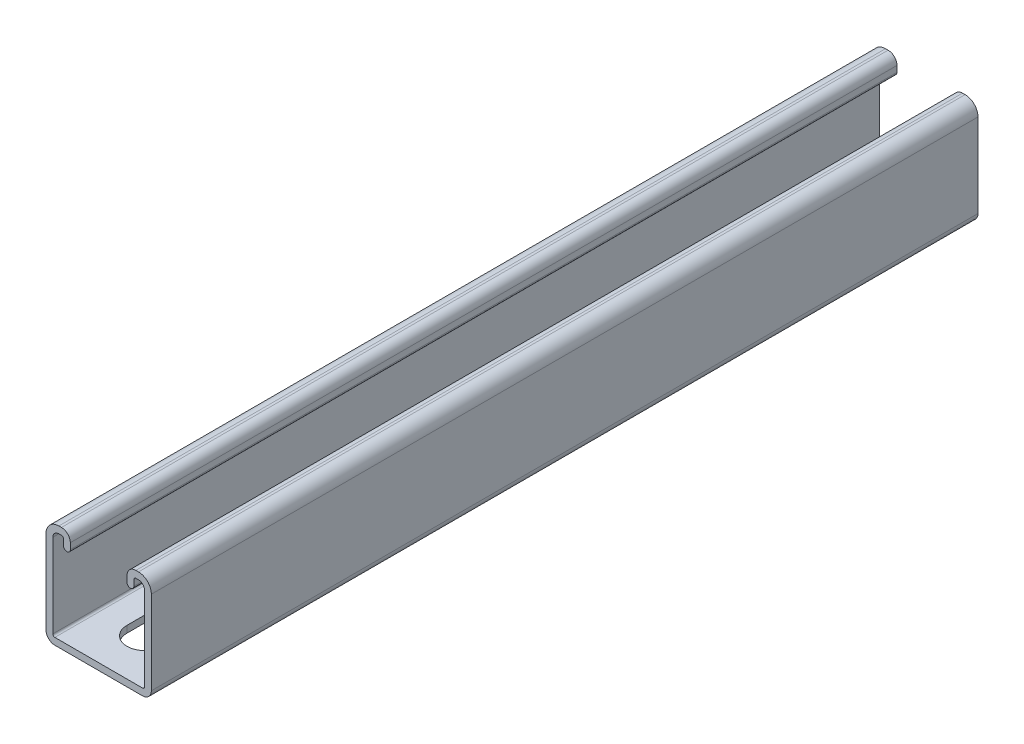
from build123d import *

# Parameters (mm, degrees)
PRIMARY_EXTRUSION_DEPTH = 323.85
SLOT_CUT_REACH          = 329.121
LPATTERN1_COUNT         = 7
LPATTERN1_PITCH         = 50.8


with BuildPart() as part:
    # Sketch1 → Primary Extrusion (new body)
    with BuildSketch(Plane.XY):
        with BuildLine():
            Line((17.176891111, -17.970376528), (-17.176891111, -17.970376528))
            ThreePointArc((-17.176891111, -17.970376528), (-17.738157147, -17.737892523), (-17.970641152, -17.176626487))
            Line((-17.970641152, -17.176626487), (-17.970641152, 15.589126408))
            ThreePointArc((-17.970641152, 15.589126408), (-17.273189139, 17.272924515), (-15.589391032, 17.970376528))
            Line((-15.589391032, 17.970376528), (-14.57342631, 17.970376528))
            ThreePointArc((-14.57342631, 17.970376528), (-14.012171972, 17.737897369), (-13.779692813, 17.176643031))
            Line((-13.779692813, 17.176643031), (-13.779692813, 14.833457753))
            ThreePointArc((-13.779692813, 14.833457753), (-12.446175174, 13.499940114), (-11.112657535, 14.833457753))
            Line((-11.112657535, 14.833457753), (-11.112657535, 17.176643031))
            ThreePointArc((-11.112657535, 17.176643031), (-12.126293241, 19.623776099), (-14.57342631, 20.637411806))
            Line((-14.57342631, 20.637411806), (-15.589391032, 20.637411806))
            ThreePointArc((-15.589391032, 20.637411806), (-19.15906787, 19.158803246), (-20.637676429, 15.589126408))
            Line((-20.637676429, 15.589126408), (-20.637676429, -17.176626487))
            ThreePointArc((-20.637676429, -17.176626487), (-19.624035878, -19.623771254), (-17.176891111, -20.637411806))
            Line((-17.176891111, -20.637411806), (17.176891111, -20.637411806))
            ThreePointArc((17.176891111, -20.637411806), (19.624035878, -19.623771254), (20.637676429, -17.176626487))
            Line((20.637676429, -17.176626487), (20.637676429, 15.589126408))
            ThreePointArc((20.637676429, 15.589126408), (19.15906787, 19.158803246), (15.589391032, 20.637411806))
            Line((15.589391032, 20.637411806), (14.57342631, 20.637411806))
            ThreePointArc((14.57342631, 20.637411806), (12.126293241, 19.623776099), (11.112657535, 17.176643031))
            Line((11.112657535, 17.176643031), (11.112657535, 14.833457753))
            ThreePointArc((11.112657535, 14.833457753), (12.446175174, 13.499940114), (13.779692813, 14.833457753))
            Line((13.779692813, 14.833457753), (13.779692813, 17.176643031))
            ThreePointArc((13.779692813, 17.176643031), (14.012171972, 17.737897369), (14.57342631, 17.970376528))
            Line((14.57342631, 17.970376528), (15.589391032, 17.970376528))
            ThreePointArc((15.589391032, 17.970376528), (17.273189139, 17.272924515), (17.970641152, 15.589126408))
            Line((17.970641152, 15.589126408), (17.970641152, -17.176626487))
            ThreePointArc((17.970641152, -17.176626487), (17.738157147, -17.737892523), (17.176891111, -17.970376528))
        make_face()
    extrude(amount=-PRIMARY_EXTRUSION_DEPTH)

    # Sketch58 → Slot Cut (cut, up to next)
    with BuildSketch(Plane(origin=(0, -20.637411806, 0), x_dir=(-1, 0, 0), z_dir=(0, 1, 0)), mode=Mode.PRIVATE) as slot_cut_sk1:
        with BuildLine():
            Line((7.14375, -32.54375), (7.14375, -18.25625))
            ThreePointArc((7.14375, -18.25625), (0, -11.1125), (-7.14375, -18.25625))
            Line((-7.14375, -18.25625), (-7.14375, -32.54375))
            ThreePointArc((-7.14375, -32.54375), (0, -39.6875), (7.14375, -32.54375))
        make_face()
    slot_cut_tool1 = extrude(slot_cut_sk1.sketch, amount=SLOT_CUT_REACH, mode=Mode.PRIVATE) & part.part
    slot_cut = slot_cut_tool1.solids().sort_by_distance((0, -20.637412, -25.4))[0]
    add(slot_cut, mode=Mode.SUBTRACT)

    # LPattern1: Slot Cut ×7
    with Locations(*[(0, 0, -i * LPATTERN1_PITCH) for i in range(1, LPATTERN1_COUNT)]):
        add(slot_cut, mode=Mode.SUBTRACT)


solid = part.part
